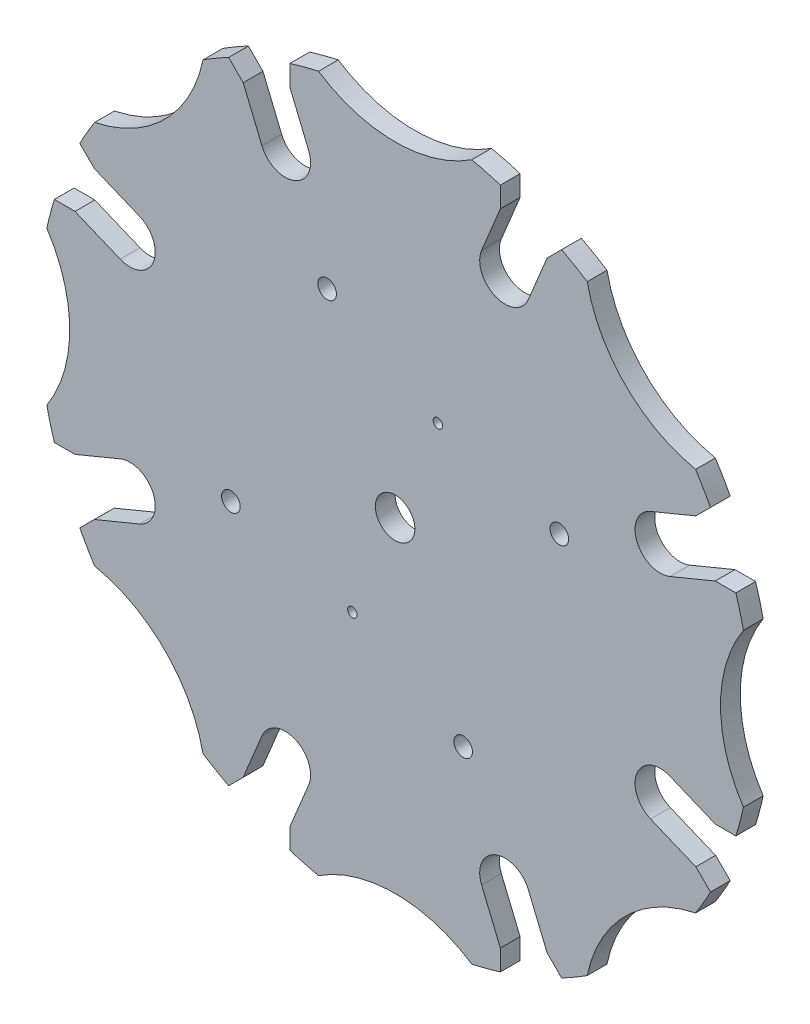
from build123d import *

# Parameters (mm, degrees)
SKETCH1_R           = 57.332002373
BOSS_EXTRUDE1_DEPTH = 3.175
CUT_EXTRUDE1_START  = -3.175
CUT_EXTRUDE1_DEPTH  = 3.175
CIRPATTERN1_COUNT   = 8
CUT_EXTRUDE2_REACH  = 81.25
SKETCH3_R           = 3.175
CUT_EXTRUDE3_REACH  = 81.25
SKETCH4_R           = 0.762
CHAMFER1_SIZE       = 3.175
CUT_EXTRUDE4_REACH  = 81.25
SKETCH5_R           = 1.4986
CIRPATTERN2_COUNT   = 4


with BuildPart() as part:
    # Sketch1 → Boss-Extrude1 (new body)
    with BuildSketch(Plane.XY):
        Circle(SKETCH1_R)
    extrude(amount=BOSS_EXTRUDE1_DEPTH)

    # Sketch2 → Cut-Extrude1 (cut)
    with BuildSketch(Plane.XY.offset(3.175).offset(CUT_EXTRUDE1_START)):
        with BuildLine():
            Line((62.131865528, 30.134703259), (41.073015989, 21.411842172))
            ThreePointArc((41.073015989, 21.411842172), (38.873595038, 16.101970283), (44.183466927, 13.902549332))
            Line((44.183466927, 13.902549332), (54.389846688, 18.130170251))
            ThreePointArc((54.389846688, 18.130170251), (55.267949497, 15.245073122), (55.99312865, 12.317793637))
            ThreePointArc((55.99312865, 12.317793637), (52.309071806, 0), (55.99312865, -12.317793637))
            ThreePointArc((55.99312865, -12.317793637), (55.267949497, -15.245073122), (54.389846688, -18.130170251))
            Line((54.389846688, -18.130170251), (44.183466927, -13.902549332))
            ThreePointArc((44.183466927, -13.902549332), (38.873595038, -16.101970283), (41.073015989, -21.411842172))
            Line((41.073015989, -21.411842172), (62.131865528, -30.134703259))
            ThreePointArc((62.131865528, -30.134703259), (69.054102373, 0), (62.131865528, 30.134703259))
        make_face()
    cut_extrude1 = extrude(amount=CUT_EXTRUDE1_DEPTH, mode=Mode.SUBTRACT)

    # CirPattern1: Cut-Extrude1 ×8 about axis
    cirpattern1_axis = Axis((0, 0, 0), (0, 0, 1))
    for i in range(1, CIRPATTERN1_COUNT):
        add(cut_extrude1.rotate(cirpattern1_axis, i * 360 / CIRPATTERN1_COUNT), mode=Mode.SUBTRACT)

    # Sketch3 → Cut-Extrude2 (cut, up to next)
    with BuildSketch(Plane.XY.offset(3.175), mode=Mode.PRIVATE) as cut_extrude2_sk1:
        Circle(SKETCH3_R)
    cut_extrude2_tool1 = extrude(cut_extrude2_sk1.sketch, amount=-CUT_EXTRUDE2_REACH, mode=Mode.PRIVATE) & part.part
    add(cut_extrude2_tool1.solids().sort_by_distance((0, 0, 3.175))[0], mode=Mode.SUBTRACT)

    # Sketch4 → Cut-Extrude3 (cut, up to next)
    with BuildSketch(Plane.XY.offset(3.175), mode=Mode.PRIVATE) as cut_extrude3_sk1:
        with Locations((6.873190472, 16.593349654)):
            Circle(SKETCH4_R)
    cut_extrude3_tool1 = extrude(cut_extrude3_sk1.sketch, amount=-CUT_EXTRUDE3_REACH, mode=Mode.PRIVATE) & part.part
    # Sketch4 → Cut-Extrude3 (cut, up to next)
    with BuildSketch(Plane.XY.offset(3.175), mode=Mode.PRIVATE) as cut_extrude3_sk2:
        with Locations((-6.873190472, -16.593349654)):
            Circle(SKETCH4_R)
    cut_extrude3_tool2 = extrude(cut_extrude3_sk2.sketch, amount=-CUT_EXTRUDE3_REACH, mode=Mode.PRIVATE) & part.part
    add(cut_extrude3_tool1.solids().sort_by_distance((6.87319, 16.59335, 3.175))[0], mode=Mode.SUBTRACT)
    add(cut_extrude3_tool2.solids().sort_by_distance((-6.87319, -16.59335, 3.175))[0], mode=Mode.SUBTRACT)

    # Chamfer1
    # the kernel refuses this chamfer: 3.175, 1.27 mm, written as the material it takes off along each edge
    with BuildSketch(Plane(origin=(-51.279395749, 25.639463092, -8.232085276), x_dir=(0.4570542890286377, 0.8894387988392043, 0), z_dir=(0, 0, 1)), Plane(origin=(-18.130170251, 54.389846688, -8.232085276), x_dir=(0.9521143932521638, 0.3057420189670758, 0), z_dir=(0, 0, 1)), Plane(origin=(25.639463092, 51.279395749, -8.232085276), x_dir=(0.8894387988392037, -0.4570542890286388, 0), z_dir=(0, 0, 1)), Plane(origin=(54.389846688, 18.130170251, -8.232085276), x_dir=(0.30574201896707504, -0.9521143932521642, 0), z_dir=(0, 0, 1)), Plane(origin=(25.639463092, -51.279395749, 11.407085276), x_dir=(0.8894387988391999, 0.45705428902864664, 0), z_dir=(0, 0, -1)), Plane(origin=(-18.130170251, -54.389846688, 11.407085276), x_dir=(0.952114393252168, -0.305742018967063, 0), z_dir=(0, 0, -1)), Plane(origin=(-51.279395749, -25.639463092, 11.407085276), x_dir=(0.4570542890286467, -0.8894387988391996, 0), z_dir=(0, 0, -1))) as chamfer1_piece_1:
        with BuildLine():
            Line((1.265469022, 0), (CHAMFER1_SIZE * 0.0818896104616, -CHAMFER1_SIZE * 0.996641405772))
            Line((CHAMFER1_SIZE * 0.0818896104616, -CHAMFER1_SIZE * 0.996641405772), (0, 0))
            ThreePointArc((0, 0), (0.65194513, 0.003488419), (1.265469022, 0))
        make_face()
    extrude(amount=19.639170553, mode=Mode.SUBTRACT)
    with BuildSketch(Plane(origin=(-54.389846688, 18.130170251, 11.407085276), x_dir=(0.9238795325112874, -0.3826834323650885, 0), z_dir=(0, 0, -1)), Plane(origin=(-25.639463092, 51.279395749, 11.407085276), x_dir=(0.3826834323650902, -0.9238795325112866, 0), z_dir=(0, 0, -1)), Plane(origin=(18.130170251, 54.389846688, 11.407085276), x_dir=(-0.3826834323650892, -0.923879532511287, 0), z_dir=(0, 0, -1)), Plane(origin=(51.279395749, 25.639463092, 11.407085276), x_dir=(-0.9238795325112859, -0.38268343236509195, 0), z_dir=(0, 0, -1)), Plane(origin=(18.130170251, -54.389846688, -8.232085276), x_dir=(-0.38268343236509117, 0.9238795325112862, 0), z_dir=(0, 0, 1)), Plane(origin=(-25.639463092, -51.279395749, -8.232085276), x_dir=(0.3826834323650892, 0.923879532511287, 0), z_dir=(0, 0, 1)), Plane(origin=(-54.389846688, -18.130170251, -8.232085276), x_dir=(0.9238795325112866, 0.3826834323650902, 0), z_dir=(0, 0, 1))) as chamfer1_piece_2:
        with BuildLine():
            Line((CHAMFER1_SIZE, 0), (0.103628765, 1.261218825))
            ThreePointArc((0.103628765, 1.261218825), (0.04991083, 0.650041176), (0, 0))
            Line((0, 0), (CHAMFER1_SIZE, 0))
        make_face()
    extrude(amount=19.639170553, mode=Mode.SUBTRACT)
    with BuildSketch(Plane(origin=(51.279395749, -25.639463092, 11.407085276), x_dir=(-0.9238795325112863, 0.382683432365091, 0), z_dir=(0, 0, -1))) as chamfer1_piece_3:
        with BuildLine():
            Line((CHAMFER1_SIZE, 0), (0.103628765, -1.261218825))
            ThreePointArc((0.103628765, -1.261218825), (0.04991083, -0.650041176), (0, 0))
            Line((0, 0), (CHAMFER1_SIZE, 0))
        make_face()
    extrude(amount=19.639170553, mode=Mode.SUBTRACT)
    with BuildSketch(Plane(origin=(54.389846688, -18.130170251, -8.232085276), x_dir=(0.3057420189670742, 0.9521143932521645, 0), z_dir=(0, 0, 1))) as chamfer1_piece_4:
        with BuildLine():
            Line((1.265469022, 0), (CHAMFER1_SIZE * 0.0818896104616, CHAMFER1_SIZE * 0.996641405772))
            Line((CHAMFER1_SIZE * 0.0818896104616, CHAMFER1_SIZE * 0.996641405772), (0, 0))
            ThreePointArc((0, 0), (0.65194513, -0.003488419), (1.265469022, 0))
        make_face()
    extrude(amount=19.639170553, mode=Mode.SUBTRACT)

    # Sketch5 → Cut-Extrude4 (cut, up to next)
    with BuildSketch(Plane.XY.offset(3.175), mode=Mode.PRIVATE) as cut_extrude4_sk1:
        with Locations((-10.93517908, 26.399857642)):
            Circle(SKETCH5_R)
    cut_extrude4_tool1 = extrude(cut_extrude4_sk1.sketch, amount=-CUT_EXTRUDE4_REACH, mode=Mode.PRIVATE) & part.part
    cut_extrude4 = cut_extrude4_tool1.solids().sort_by_distance((-10.935179, 26.399858, 3.175))[0]
    add(cut_extrude4, mode=Mode.SUBTRACT)

    # CirPattern2: Cut-Extrude4 ×4 about axis
    cirpattern2_axis = Axis((0, 0, 0), (0, 0, 1))
    for i in range(1, CIRPATTERN2_COUNT):
        add(cut_extrude4.rotate(cirpattern2_axis, i * 360 / CIRPATTERN2_COUNT), mode=Mode.SUBTRACT)


solid = part.part
